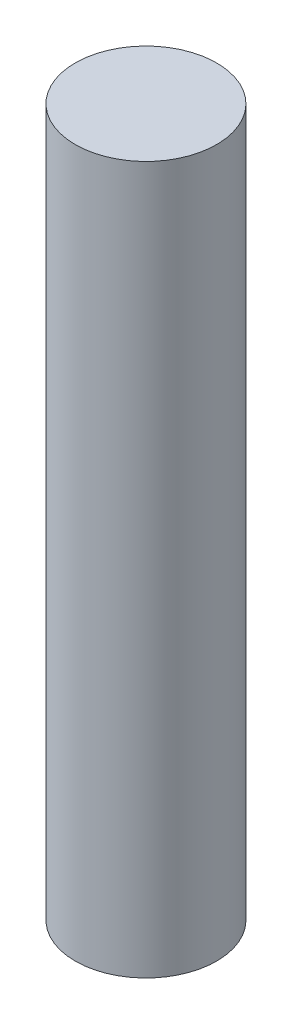
from build123d import *

# Parameters (mm, degrees)
SKETCH_1_R      = 150
EXTRUDE_1_DEPTH = 1500


with BuildPart() as part:
    # 草图1 → 凸台-拉伸1 (new body)
    with BuildSketch(Plane(origin=(0, 0, 0), x_dir=(1, 0, 0), z_dir=(0, 1, 0))):
        Circle(SKETCH_1_R)
    extrude(amount=EXTRUDE_1_DEPTH)


solid = part.part
